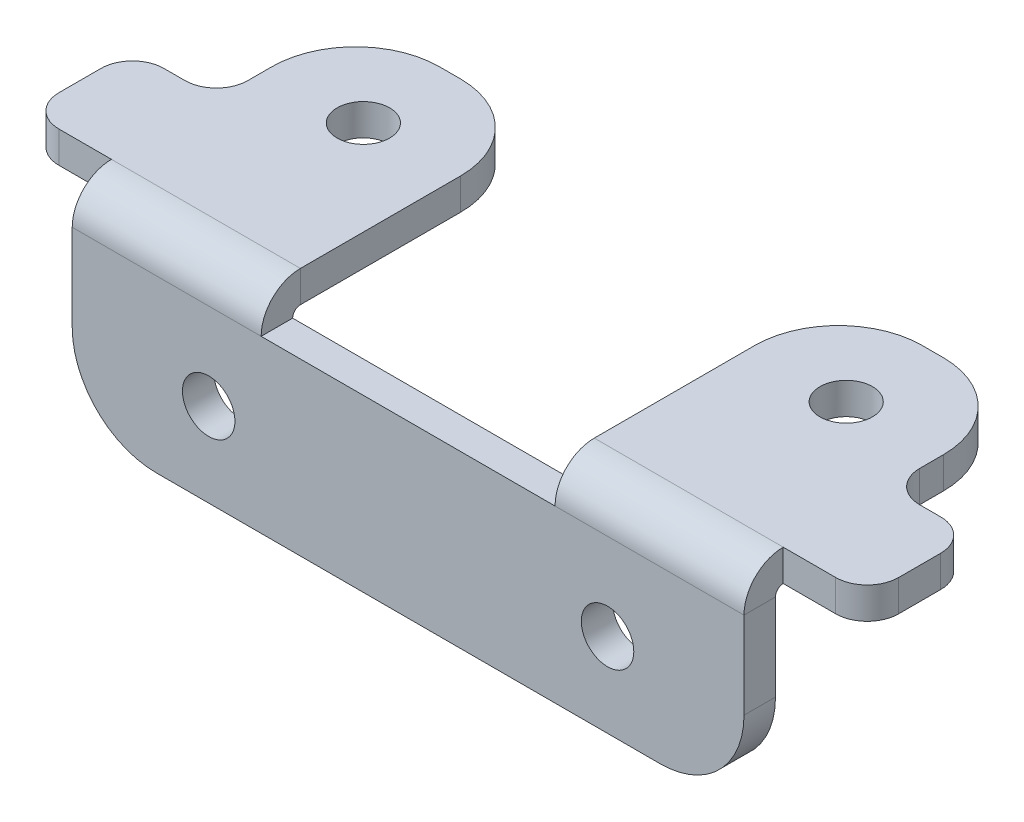
from build123d import *

# Parameters (mm, degrees)
SKETCH2_W            = 64
SKETCH2_H            = 16.26
BASE_FLANGE1_DEPTH   = 3
EDGE_FLANGE1_DEPTH   = 18
SKETCH10_R           = 2.5
CUT_EXTRUDE1_DEPTH   = 3
FILLET1_R            = 8
SKETCH14_R           = 2.5
SKETCH14_R_2         = 1
CUT_EXTRUDE5_DEPTH   = 3
SKETCH15_W           = 8
SKETCH15_H           = 10
TAB1_DEPTH           = 3
FILLET4_R            = 8
FILLET5_R            = 3
FILLET4_OF_MIRROR1_R = 8
FILLET5_OF_MIRROR1_R = 3


# Sheet-metal steps are written as plain solids
with BuildPart() as part:
    # Sketch2 → Base-Flange1 (new body)
    with BuildSketch(Plane.XY):
        Rectangle(SKETCH2_W, SKETCH2_H)
    extrude(amount=-BASE_FLANGE1_DEPTH)

    # Edge-Flange1 section (across the edge) → Edge-Flange1 (add)
    with BuildSketch(Plane(origin=(14, 8.8666, -3), x_dir=(0, -1, 0), z_dir=(1, 0, 0))):
        with BuildLine():
            Line((-3, 0.7366), (-3, 24))
            Line((-3, 24), (0, 24))
            Line((0, 24), (0, 0.7366))
            ThreePointArc((0, 0.7366), (0.215745145, 0.215745145), (0.7366, 0))
            Line((0.7366, 0), (0.7366, -3))
            ThreePointArc((0.7366, -3), (-1.905575199, -1.905575199), (-3, 0.7366))
        make_face()
    edge_flange1 = extrude(amount=EDGE_FLANGE1_DEPTH)

    # Sketch10 → Cut-Extrude1 (cut)
    with BuildSketch(Plane.XY):
        with Locations((-19, -0.13)):
            Circle(SKETCH10_R)
        with Locations((19, -0.13)):
            Circle(SKETCH10_R)
    extrude(amount=-CUT_EXTRUDE1_DEPTH, mode=Mode.SUBTRACT)

    # Fillet1
    fillet1_edges = [part.edges().sort_by_distance(p)[0] for p in [
        (32, -8.13, -1.5),
        (-32, -8.13, -1.5),
    ]]
    fillet(fillet1_edges, radius=FILLET1_R)

    # Sketch14 → Cut-Extrude5 (cut)
    with BuildSketch(Plane(origin=(0, 11.8666, 0), x_dir=(1, 0, 0), z_dir=(0, 1, 0))):
        with Locations(Location((23, 18.7366, 0), (0, 0, 270))):
            Circle(SKETCH14_R)
        with Locations((37, 22)):
            Circle(SKETCH14_R_2)
    cut_extrude5 = extrude(amount=-CUT_EXTRUDE5_DEPTH, mode=Mode.SUBTRACT)

    # Sketch15 → Tab1 (add)
    with BuildSketch(Plane(origin=(0, 11.8666, 0), x_dir=(1, 0, 0), z_dir=(0, 1, 0))):
        with Locations((36, 8.7366)):
            Rectangle(SKETCH15_W, SKETCH15_H)
    tab1 = extrude(amount=-TAB1_DEPTH)

    # Fillet4
    fillet4_edges = [part.edges().sort_by_distance(p)[0] for p in [
        (14, 10.3666, -27),
        (32, 10.3666, -27),
    ]]
    fillet(fillet4_edges, radius=FILLET4_R)

    # Fillet5
    fillet5_edges = [part.edges().sort_by_distance(p)[0] for p in [
        (32, 10.3666, -13.7366),
        (40, 10.3666, -13.7366),
        (40, 10.3666, -3.7366),
    ]]
    fillet(fillet5_edges, radius=FILLET5_R)

    # Mirror1: Edge-Flange1, Cut-Extrude5, Tab1 across plane
    add(edge_flange1.mirror(Plane(origin=(0, 0, 0), x_dir=(0, 0, 1), z_dir=(1, 0, 0))))
    add(cut_extrude5.mirror(Plane(origin=(0, 0, 0), x_dir=(0, 0, 1), z_dir=(1, 0, 0))), mode=Mode.SUBTRACT)
    add(tab1.mirror(Plane(origin=(0, 0, 0), x_dir=(0, 0, 1), z_dir=(1, 0, 0))))

    # Fillet4 of Mirror1
    fillet4_of_mirror1_edges = [part.edges().sort_by_distance(p)[0] for p in [
        (-14, 10.3666, -27),
        (-32, 10.3666, -27),
    ]]
    fillet(fillet4_of_mirror1_edges, radius=FILLET4_OF_MIRROR1_R)

    # Fillet5 of Mirror1
    fillet5_of_mirror1_edges = [part.edges().sort_by_distance(p)[0] for p in [
        (-32, 10.3666, -13.7366),
        (-40, 10.3666, -13.7366),
        (-40, 10.3666, -3.7366),
    ]]
    fillet(fillet5_of_mirror1_edges, radius=FILLET5_OF_MIRROR1_R)


solid = part.part
